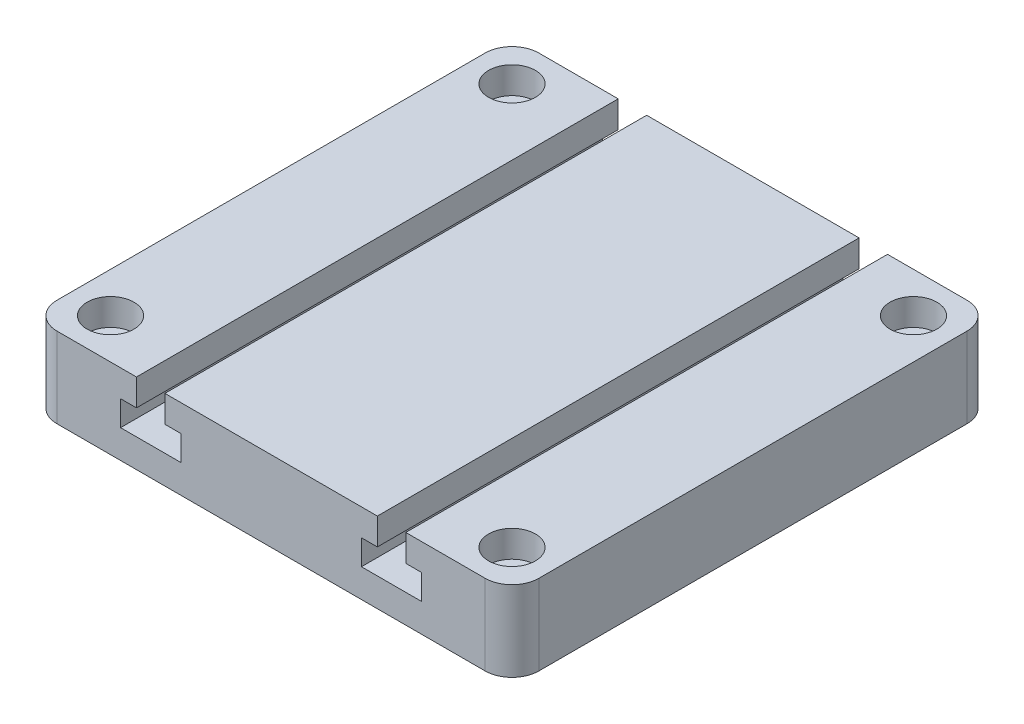
from build123d import *

# Parameters (mm, degrees)
SKETCH1_W                                        = 114.3
SKETCH1_H                                        = 114.3
BOSS_EXTRUDE1_DEPTH                              = 19.05
CBORE_FOR_1_4_SOCKET_HEAD_CAP_SCREW1_D           = 6.5278
CBORE_FOR_1_4_SOCKET_HEAD_CAP_SCREW1_CBORE_D     = 11.1125
CBORE_FOR_1_4_SOCKET_HEAD_CAP_SCREW1_CBORE_DEPTH = 6.35
T_SLOT_CUT_WITH_MCMASTER_8789A16_BIT_DEPTH       = 130.203386179
FILLET1_R                                        = 6.35


with BuildPart() as part:
    # Sketch1 → Boss-Extrude1 (new body)
    with BuildSketch(Plane(origin=(0, 0, 0), x_dir=(1, 0, 0), z_dir=(0, 1, 0))):
        Rectangle(SKETCH1_W, SKETCH1_H)
    extrude(amount=BOSS_EXTRUDE1_DEPTH)

    # CBORE for 1/4 Socket Head Cap Screw1 (through all)
    with Locations(Plane(origin=(0, 19.05, 0), x_dir=(1, 0, 0), z_dir=(0, 1, 0))):
        with Locations((-47.625, 47.625), (47.625, 47.625), (47.625, -47.625), (-47.625, -47.625)):
            CounterBoreHole(CBORE_FOR_1_4_SOCKET_HEAD_CAP_SCREW1_D / 2, CBORE_FOR_1_4_SOCKET_HEAD_CAP_SCREW1_CBORE_D / 2, CBORE_FOR_1_4_SOCKET_HEAD_CAP_SCREW1_CBORE_DEPTH)

    # Sketch4 → T-SLOT CUT WITH MCMASTER 8789A16 BIT (cut, through all)
    with BuildSketch(Plane.XY.offset(57.15)):
        Polygon((-31.9484375, 19.05), (-31.9484375, 12.7), (-35.71875, 12.7), (-35.71875, 6.746875), (-21.43125, 6.746875), (-21.43125, 12.7), (-25.2015625, 12.7), (-25.2015625, 19.05), align=None)
        Polygon((25.2015625, 12.7), (25.2015625, 19.05), (31.9484375, 19.05), (31.9484375, 12.7), (35.71875, 12.7), (35.71875, 6.746875), (21.43125, 6.746875), (21.43125, 12.7), align=None)
    extrude(amount=-T_SLOT_CUT_WITH_MCMASTER_8789A16_BIT_DEPTH, mode=Mode.SUBTRACT)

    # Fillet1
    fillet1_edges = [part.edges().sort_by_distance(p)[0] for p in [
        (-57.15, 9.525, 57.15),
        (57.15, 9.525, 57.15),
        (57.15, 9.525, -57.15),
        (-57.15, 9.525, -57.15),
    ]]
    fillet(fillet1_edges, radius=FILLET1_R)


solid = part.part
